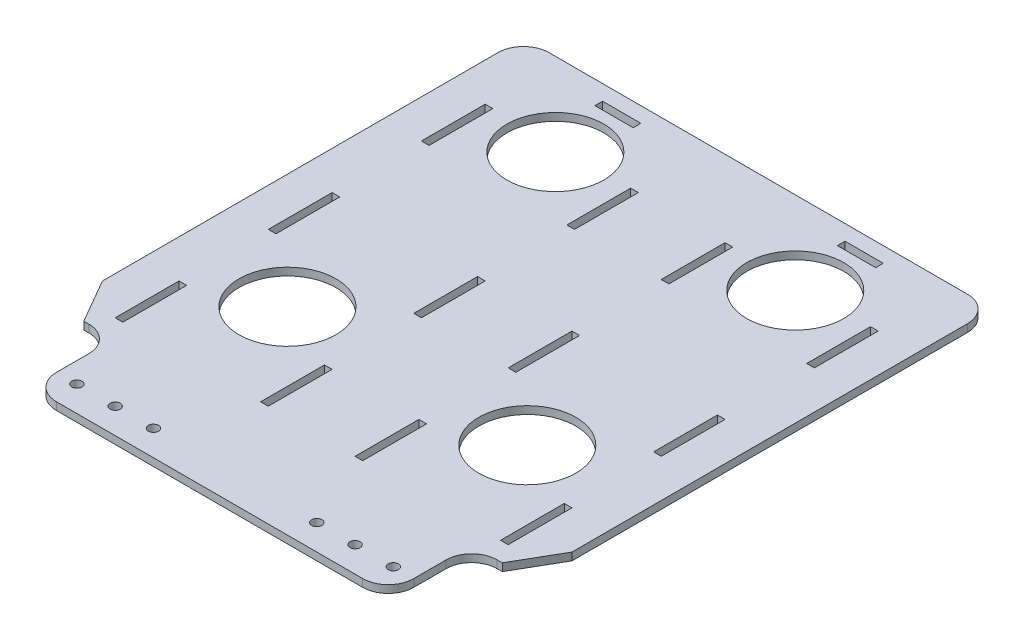
from build123d import *

# Parameters (mm, degrees)
SKETCH_1_W          = 164
SKETCH_1_H          = 215
SKETCH_1_R          = 19
EXTRUDE_1_DEPTH     = 3
SKETCH_2_R          = 2
CUT_EXTRUDE_1_DEPTH = 3
SKETCH_3_W          = 3
SKETCH_3_H          = 25
CUT_EXTRUDE_2_DEPTH = 10
SKETCH_4_W          = 15
SKETCH_4_H          = 3
CUT_EXTRUDE_3_DEPTH = 10
SKETCH_6_W          = 10
SKETCH_6_H          = 190
EXTRUDE_2_DEPTH     = 3
CHAMFER_1_SIZE      = 25
CHAMFER_1_SIZE_2    = 14.43375673
FILLET_4_R          = 10
SKETCH_7_W          = 20
SKETCH_7_H          = 32.679491924
CUT_EXTRUDE_4_DEPTH = 10
FILLET_5_R          = 10
FILLET_6_R          = 10


with BuildPart() as part:
    # 草图1 → 凸台-拉伸1 (new body)
    with BuildSketch(Plane(origin=(0, 0, 0), x_dir=(1, 0, 0), z_dir=(0, 1, 0))):
        with Locations((47, 70)):
            Rectangle(SKETCH_1_W, SKETCH_1_H)
        with Locations(Location((94, 40, 0), (0, 0, 270))):
            Circle(SKETCH_1_R, mode=Mode.SUBTRACT)
        with Locations(Location((0, 40, 0), (0, 0, 270))):
            Circle(SKETCH_1_R, mode=Mode.SUBTRACT)
        with Locations(Location((0, 145, 0), (0, 0, 270))):
            Circle(SKETCH_1_R, mode=Mode.SUBTRACT)
        with Locations(Location((94, 145, 0), (0, 0, 270))):
            Circle(SKETCH_1_R, mode=Mode.SUBTRACT)
    extrude(amount=EXTRUDE_1_DEPTH)

    # 草图2 → 切除-拉伸1 (cut)
    with BuildSketch(Plane(origin=(0, 3, 0), x_dir=(1, 0, 0), z_dir=(0, 1, 0))):
        with Locations(Location((0, -27.5, 0), (0, 0, 270))):
            Circle(SKETCH_2_R)
        with Locations(Location((-15, -27.5, 0), (0, 0, 270))):
            Circle(SKETCH_2_R)
        with Locations(Location((15, -27.5, 0), (0, 0, 90))):
            Circle(SKETCH_2_R)
        with Locations(Location((79, -27.5, 0), (0, 0, 270))):
            Circle(SKETCH_2_R)
        with Locations(Location((109, -27.5, 0), (0, 0, 90))):
            Circle(SKETCH_2_R)
        with Locations(Location((94, -27.5, 0), (0, 0, 90))):
            Circle(SKETCH_2_R)
    extrude(amount=-CUT_EXTRUDE_1_DEPTH, mode=Mode.SUBTRACT)

    # 草图3 → 切除-拉伸2 (cut)
    with BuildSketch(Plane(origin=(0, 3, 0), x_dir=(1, 0, 0), z_dir=(0, 1, 0))):
        with Locations((28.5, 135)):
            Rectangle(SKETCH_3_W, SKETCH_3_H)
        with Locations((65.5, 135)):
            Rectangle(SKETCH_3_W, SKETCH_3_H)
        with Locations((28.5, 75)):
            Rectangle(SKETCH_3_W, SKETCH_3_H)
        with Locations((65.5, 75)):
            Rectangle(SKETCH_3_W, SKETCH_3_H)
        with Locations((28.5, 15)):
            Rectangle(SKETCH_3_W, SKETCH_3_H)
        with Locations((65.5, 15)):
            Rectangle(SKETCH_3_W, SKETCH_3_H)
        with Locations((-28.5, 15)):
            Rectangle(SKETCH_3_W, SKETCH_3_H)
        with Locations((-28.5, 75)):
            Rectangle(SKETCH_3_W, SKETCH_3_H)
        with Locations((-28.5, 135)):
            Rectangle(SKETCH_3_W, SKETCH_3_H)
        with Locations((122.5, 135)):
            Rectangle(SKETCH_3_W, SKETCH_3_H)
        with Locations((122.5, 75)):
            Rectangle(SKETCH_3_W, SKETCH_3_H)
        with Locations((122.5, 15)):
            Rectangle(SKETCH_3_W, SKETCH_3_H)
    extrude(amount=-CUT_EXTRUDE_2_DEPTH, mode=Mode.SUBTRACT)

    # 草图4 → 切除-拉伸3 (cut)
    with BuildSketch(Plane(origin=(0, 3, 0), x_dir=(1, 0, 0), z_dir=(0, 1, 0))):
        with Locations((-0.5, 170)):
            Rectangle(SKETCH_4_W, SKETCH_4_H)
        with Locations((94.5, 170)):
            Rectangle(SKETCH_4_W, SKETCH_4_H)
    extrude(amount=-CUT_EXTRUDE_3_DEPTH, mode=Mode.SUBTRACT)

    # 草图6 → 凸台-拉伸2 (add)
    with BuildSketch(Plane(origin=(0, 3, 0), x_dir=(1, 0, 0), z_dir=(0, 1, 0))):
        with Locations((-40, 82.5)):
            Rectangle(SKETCH_6_W, SKETCH_6_H)
        with Locations((134, 82.5)):
            Rectangle(SKETCH_6_W, SKETCH_6_H)
    extrude(amount=-EXTRUDE_2_DEPTH)

    # 倒角1
    # the kernel refuses this chamfer: 25, 14.43375673 mm, written as the material it takes off along each edge
    with BuildSketch(Plane(origin=(139, 67.677143866, 12.5), x_dir=(0.019326765612700705, 0, -0.9998132206222079), z_dir=(0, -1, 0))) as chamfer_1_piece_1_section:
        Polygon((CHAMFER_1_SIZE * 0.999813220622, -CHAMFER_1_SIZE * 0.0193267656127), (-CHAMFER_1_SIZE_2 * 0.0193267656124, -CHAMFER_1_SIZE_2 * 0.999813220604), (0, 0), align=None)
    chamfer_1_piece_1 = extrude(amount=132.354287732, mode=Mode.PRIVATE)
    chamfer_1_piece_1 = split(chamfer_1_piece_1, bisect_by=Plane(origin=(129, 1.5, 3.344472452), z_dir=(1, 0, 0)), keep=Keep.TOP, mode=Mode.PRIVATE)
    add(chamfer_1_piece_1, mode=Mode.SUBTRACT)
    with BuildSketch(Plane(origin=(-45, 67.677143866, 12.5), x_dir=(0.9983227437537926, 0, 0.057893862402670776), z_dir=(0, -1, 0))) as chamfer_1_piece_2_section:
        Polygon((CHAMFER_1_SIZE_2 * 0.998322743736, -CHAMFER_1_SIZE_2 * 0.0578938624016), (-CHAMFER_1_SIZE * 0.0578938624027, -CHAMFER_1_SIZE * 0.998322743754), (0, 0), align=None)
    chamfer_1_piece_2 = extrude(amount=132.354287732, mode=Mode.PRIVATE)
    chamfer_1_piece_2 = split(chamfer_1_piece_2, bisect_by=Plane(origin=(-35, 1.5, 3.344472452), z_dir=(-1, 0, 0)), keep=Keep.TOP, mode=Mode.PRIVATE)
    add(chamfer_1_piece_2, mode=Mode.SUBTRACT)

    # 圆角4
    fillet_4_edges = [part.edges().sort_by_distance(p)[0] for p in [
        (-35, 1.5, 37.5),
        (129, 1.5, 37.5),
        (-45, 1.5, -177.5),
        (139, 1.5, -177.5),
    ]]
    fillet(fillet_4_edges, radius=FILLET_4_R)

    # 草图7 → 切除-拉伸4 (cut)
    with BuildSketch(Plane(origin=(0, 3, 0), x_dir=(1, 0, 0), z_dir=(0, 1, 0))):
        with Locations((-33, -21.160254038)):
            Rectangle(SKETCH_7_W, SKETCH_7_H)
        with Locations((127, -21.160254038)):
            Rectangle(SKETCH_7_W, SKETCH_7_H)
    extrude(amount=-CUT_EXTRUDE_4_DEPTH, mode=Mode.SUBTRACT)

    # 圆角5
    fillet_5_edges = [part.edges().sort_by_distance(p)[0] for p in [
        (-23, 1.5, 37.5),
        (117, 1.5, 37.5),
    ]]
    fillet(fillet_5_edges, radius=FILLET_5_R)

    # 圆角6
    fillet_6_edges = [part.edges().sort_by_distance(p)[0] for p in [
        (-23, 1.5, 4.820508076),
        (117, 1.5, 4.820508076),
    ]]
    fillet(fillet_6_edges, radius=FILLET_6_R)


solid = part.part
